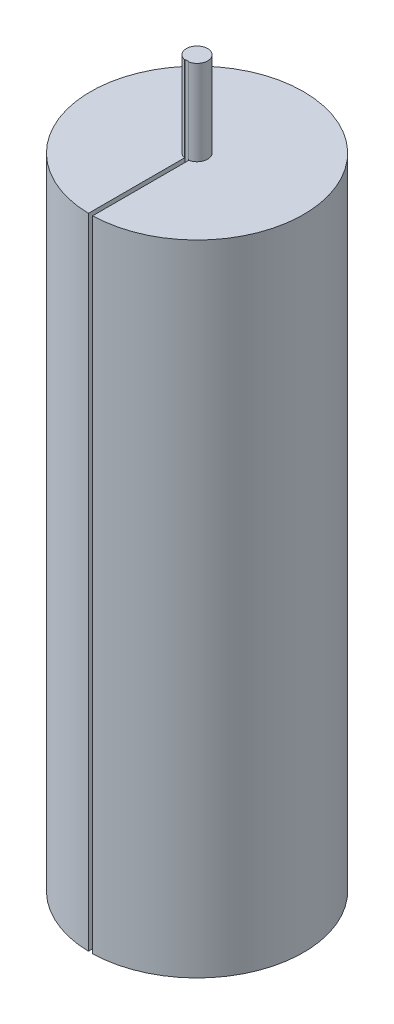
from build123d import *

# Parameters (mm, degrees)
SKETCH1_R           = 25
BOSS_EXTRUDE1_DEPTH = 150
SKETCH2_R           = 2.5
BOSS_EXTRUDE2_DEPTH = 20
SKETCH3_W           = 1
SKETCH3_H           = 26.625756483
CUT_EXTRUDE1_DEPTH  = 174.637553542


with BuildPart() as part:
    # Sketch1 → Boss-Extrude1 (new body)
    with BuildSketch(Plane(origin=(0, 0, 0), x_dir=(1, 0, 0), z_dir=(0, 1, 0))):
        Circle(SKETCH1_R)
    extrude(amount=BOSS_EXTRUDE1_DEPTH)

    # Sketch2 → Boss-Extrude2 (add)
    with BuildSketch(Plane(origin=(0, 150, 0), x_dir=(1, 0, 0), z_dir=(0, 1, 0))):
        Circle(SKETCH2_R)
    extrude(amount=BOSS_EXTRUDE2_DEPTH)

    # Sketch3 → Cut-Extrude1 (cut, through all)
    with BuildSketch(Plane.XZ):
        with Locations((0, 15.674840511)):
            Rectangle(SKETCH3_W, SKETCH3_H)
    extrude(amount=-CUT_EXTRUDE1_DEPTH, mode=Mode.SUBTRACT)


solid = part.part
